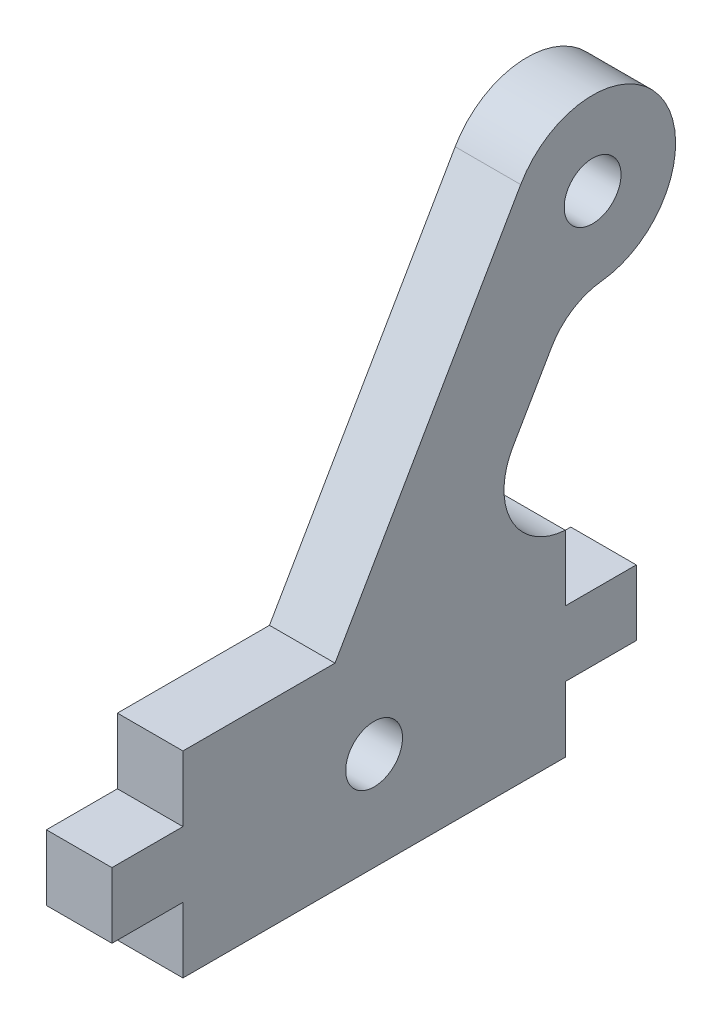
from build123d import *

# Parameters (mm, degrees)
BASE_DEPTH                   = 3
FURO_DE_DI_METRO_2_6_2_6_1_D = 2.6
FILETE1_R                    = 3


with BuildPart() as part:
    # Principal → Base (new body)
    with BuildSketch(Plane(origin=(0, 0, 0), x_dir=(0, 0, -1), z_dir=(1, 0, 0))):
        with BuildLine():
            Line((-12, 1.5), (-12, -1.5))
            Line((-12, -1.5), (-8.75, -1.5))
            Line((-8.75, -1.5), (-8.75, -4.5))
            Line((-8.75, -4.5), (8.75, -4.5))
            Line((8.75, -4.5), (8.75, -1.5))
            Line((8.75, -1.5), (12, -1.5))
            Line((12, -1.5), (12, 1.5))
            Line((12, 1.5), (8.75, 1.5))
            Line((8.75, 1.5), (8.75, 4.5))
            Line((8.75, 4.5), (3.75277675, 4.5))
            Line((3.75277675, 4.5), (9.032995126, 13.645606502))
            ThreePointArc((9.032995126, 13.645606502), (13.507465323, 18.782591182), (6.709103466, 19.220508076))
            Line((6.709103466, 19.220508076), (-1.789785834, 4.5))
            Line((-1.789785834, 4.5), (-8.75, 4.5))
            Line((-8.75, 4.5), (-8.75, 1.5))
            Line((-8.75, 1.5), (-12, 1.5))
        make_face()
    extrude(amount=BASE_DEPTH)

    # Furo de diâmetro Ø2.6 (2.6)1 (through all)
    with Locations(Plane(origin=(3, 0, 0), x_dir=(0, 0, -1), z_dir=(1, 0, 0))):
        with Locations((0, 0), (10, 17.320508076)):
            Hole(FURO_DE_DI_METRO_2_6_2_6_1_D / 2)

    # Filete1
    # the kernel refuses this fillet: 3 mm, written as the material it adds along each edge
    with BuildSketch(Plane(origin=(0, 4.5, -3.75277675), x_dir=(0, 0.8660254037844399, -0.49999999999999784), z_dir=(1, 0, 0))) as filete1_piece_1:
        with BuildLine():
            CenterArc((5.188807443, -3), FILETE1_R, 90, 116.268234178)
            Line((2.498611625, -4.327722283), (2.444807709, -4.354276729))
            ThreePointArc((2.444807709, -4.354276729), (1.197344288, -2.193861142), (-0.051961524, -0.03))
            Line((-0.051961524, -0.03), (0, 0.06))
            Line((0, 0.06), (5.188807443, 0.06))
            Line((5.188807443, 0.06), (5.188807443, 0))
        make_face()
    extrude(amount=3)
    with BuildSketch(Plane(origin=(0, 13.645606502, -9.032995126), x_dir=(0, -0.07594112145280421, -0.9971123036411147), z_dir=(1, 0, 0))) as filete1_piece_2:
        with BuildLine():
            CenterArc((1.91116971, -2.950835533), FILETE1_R, 100.387177891, 53.968120928)
            Line((-0.793315729, -1.652467898), (-0.847405437, -1.626500546))
            Line((-0.847405437, -1.626500546), (-0.054089709, 0.025967353))
            Line((-0.054089709, 0.025967353), (0.010817942, 0.059016711))
            ThreePointArc((0.010817942, 0.059016711), (0.685136311, -0.002274992), (1.35945468, 0.059016711))
            Line((1.35945468, 0.059016711), (1.370272622, 0))
        make_face()
    extrude(amount=3)


solid = part.part
